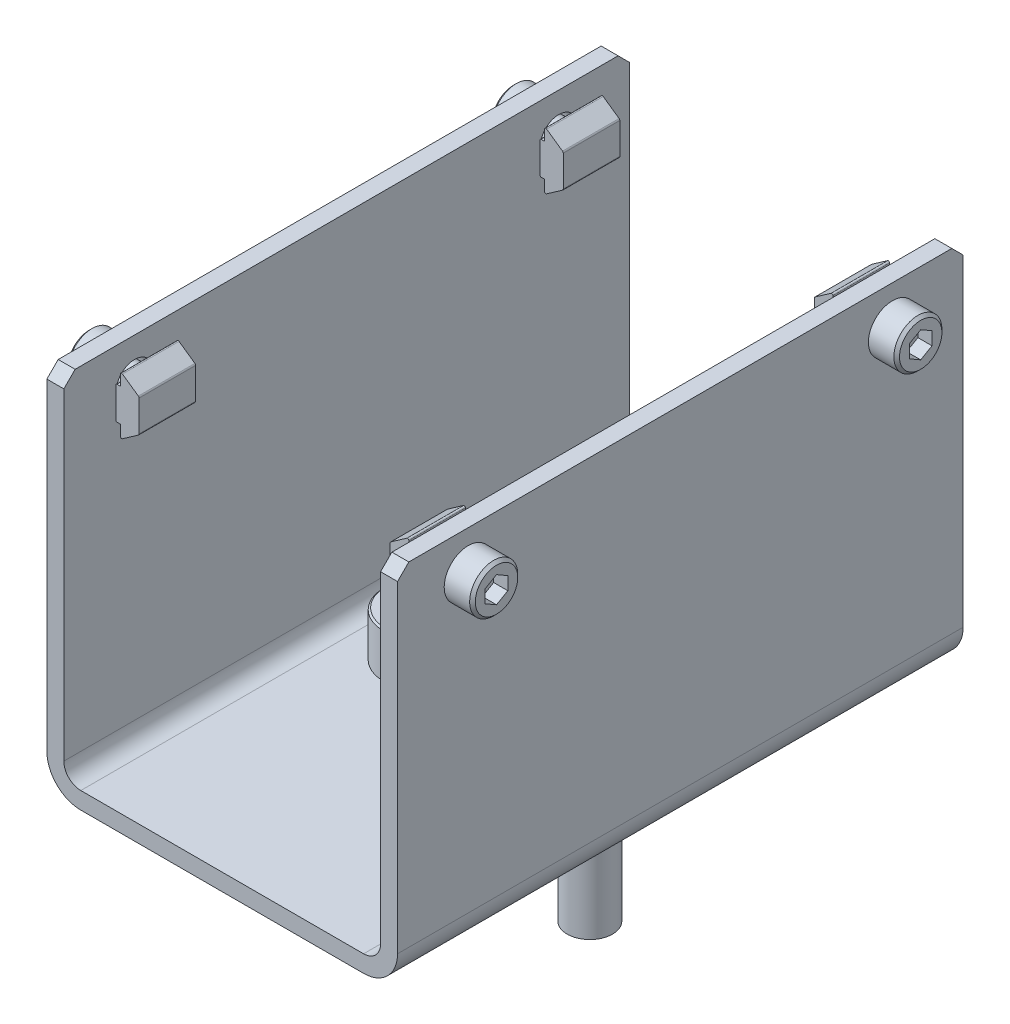
from build123d import *

# Parameters (mm, degrees)
BOSS_EXTRUDE1_DEPTH      = 50
SKETCH2_R                = 3.25
CUT_EXTRUDE1_DEPTH       = 103.805641869
CHAMFER1_SIZE            = 2
SKETCH3_R                = 4.5
CUT_EXTRUDE2_DEPTH       = 86.469292731
CUT_EXTRUDE3_DEPTH       = 2.5
CHAMFER2_SIZE            = 0.5
BOSS_EXTRUDE2_DEPTH      = 5
CHAMFER2_OF_MIRROR1_SIZE = 0.5
CUT_EXTRUDE4_DEPTH       = 4
CHAMFER3_SIZE            = 0.3


# Read off the part's stored shape, not the designer's step: Mirror2
with BuildPart() as part:
    # Sketch1 → Boss-Extrude1 (new, symmetric)
    with BuildSketch(Plane.XY):
        with BuildLine():
            Line((-25, 0), (25, 0))
            ThreePointArc((25, 0), (29.242640687, 1.757359313), (31, 6))
            Line((31, 6), (31, 65))
            Line((31, 65), (28, 65))
            Line((28, 65), (28, 6))
            ThreePointArc((28, 6), (27.121320344, 3.878679656), (25, 3))
            Line((25, 3), (-25, 3))
            ThreePointArc((-25, 3), (-27.121320344, 3.878679656), (-28, 6))
            Line((-28, 6), (-28, 65))
            Line((-28, 65), (-31, 65))
            Line((-31, 65), (-31, 6))
            ThreePointArc((-31, 6), (-29.242640687, 1.757359313), (-25, 0))
        make_face()
    extrude(amount=BOSS_EXTRUDE1_DEPTH, both=True)

    # Sketch2 → Cut-Extrude1 (cut, through all)
    with BuildSketch(Plane(origin=(31, 0, 0), x_dir=(0, 0, -1), z_dir=(1, 0, 0))):
        with Locations((-37.5, 58)):
            Circle(SKETCH2_R)
        with Locations((37.5, 58)):
            Circle(SKETCH2_R)
    extrude(amount=-CUT_EXTRUDE1_DEPTH, mode=Mode.SUBTRACT)

    # Chamfer1
    chamfer1_edges = [part.edges().sort_by_distance(p)[0] for p in [
        (-29.5, 65, -50),
        (29.5, 65, -50),
        (29.5, 65, 50),
        (-29.5, 65, 50),
    ]]
    chamfer(chamfer1_edges, length=CHAMFER1_SIZE)

    # Sketch3 → Cut-Extrude2 (cut, through all)
    with BuildSketch(Plane(origin=(0, 3, 0), x_dir=(1, 0, 0), z_dir=(0, 1, 0))):
        with Locations(Location((-15, 0, 0), (0, 0, 180))):
            Circle(SKETCH3_R)
        with Locations(Location((15, 0, 0), (0, 0, 180))):
            Circle(SKETCH3_R)
    extrude(amount=-CUT_EXTRUDE2_DEPTH, mode=Mode.SUBTRACT)

    # Sketch4 → Revolve1 (revolve)
    with BuildSketch(Plane(origin=(0, 58, 0), x_dir=(1, 0, 0), z_dir=(0, 1, 0)), mode=Mode.PRIVATE) as revolve1_sk:
        Polygon((23, -40), (31, -40), (31, -41.75), (36, -41.75), (36, -37.5), (23, -37.5), align=None)
    revolve1 = revolve(revolve1_sk.sketch.rotate(Axis((36, 58, 37.5), (-1, 0, 0)), 180), axis=Axis((36, 58, 37.5), (-1, 0, 0)))

    # Sketch5 → Cut-Extrude3 (cut)
    with BuildSketch(Plane(origin=(36, 0, 0), x_dir=(0, 0, -1), z_dir=(1, 0, 0))):
        Polygon((-37.5, 60.309401077), (-39.5, 59.154700538), (-39.5, 56.845299462), (-37.5, 55.690598923), (-35.5, 56.845299462), (-35.5, 59.154700538), align=None)
    cut_extrude3 = extrude(amount=-CUT_EXTRUDE3_DEPTH, mode=Mode.SUBTRACT)

    # Chamfer2
    chamfer2_edges = [part.edges().sort_by_distance(p)[0] for p in [
        (36, 58, 41.75),
    ]]
    chamfer(chamfer2_edges, length=CHAMFER2_SIZE)

    # Sketch6 → Boss-Extrude2 (add, symmetric)
    with BuildSketch(Plane.XY.offset(37.5)):
        with BuildLine():
            Line((22.2, 60.743829885), (22.2, 55.256170115))
            ThreePointArc((22.2, 55.256170115), (22.23389675, 55.117645531), (22.327927069, 55.010424502))
            Line((22.327927069, 55.010424502), (25.140026938, 53.041370976))
            ThreePointArc((25.140026938, 53.041370976), (25.376869026, 53.025847525), (25.5, 53.228761091))
            Line((25.5, 53.228761091), (25.5, 55.1))
            Line((25.5, 55.1), (26.1, 55.1))
            ThreePointArc((26.1, 55.1), (26.241421356, 55.158578644), (26.3, 55.3))
            Line((26.3, 55.3), (26.3, 60.7))
            ThreePointArc((26.3, 60.7), (26.241421356, 60.841421356), (26.1, 60.9))
            Line((26.1, 60.9), (25.5, 60.9))
            Line((25.5, 60.9), (25.5, 62.771238909))
            ThreePointArc((25.5, 62.771238909), (25.376869026, 62.974152475), (25.140026938, 62.958629024))
            Line((25.140026938, 62.958629024), (22.327927069, 60.989575498))
            ThreePointArc((22.327927069, 60.989575498), (22.23389675, 60.882354469), (22.2, 60.743829885))
        make_face()
    boss_extrude2 = extrude(amount=BOSS_EXTRUDE2_DEPTH, both=True)

    # Mirror1: Revolve1, Cut-Extrude3, Boss-Extrude2 across plane
    add(revolve1.mirror(Plane.XY))
    add(cut_extrude3.mirror(Plane.XY), mode=Mode.SUBTRACT)
    add(boss_extrude2.mirror(Plane.XY))

    # Chamfer2 of Mirror1
    chamfer2_of_mirror1_edges = [part.edges().sort_by_distance(p)[0] for p in [
        (36, 58, -41.75),
    ]]
    chamfer(chamfer2_of_mirror1_edges, length=CHAMFER2_OF_MIRROR1_SIZE)

    # Sketch7 → Revolve2 (revolve)
    with BuildSketch(Plane.XY, mode=Mode.PRIVATE) as revolve2_sk:
        Polygon((18, 11), (21.5, 11), (21.5, 3), (19, 3), (19, -22), (15, -22), (15, 5.267949192), (18, 7), align=None)
    revolve(revolve2_sk.sketch.rotate(Axis((15, 11, 0), (0, -1, 0)), 180), axis=Axis((15, 11, 0), (0, -1, 0)))

    # Sketch8 → Cut-Extrude4 (cut)
    with BuildSketch(Plane(origin=(0, 11, 0), x_dir=(1, 0, 0), z_dir=(0, 1, 0))):
        Polygon((15, 3.464101615), (12, 1.732050808), (12, -1.732050808), (15, -3.464101615), (18, -1.732050808), (18, 1.732050808), align=None)
    extrude(amount=-CUT_EXTRUDE4_DEPTH, mode=Mode.SUBTRACT)

    # Chamfer3
    chamfer3_edges = [part.edges().sort_by_distance(p)[0] for p in [
        (21.5, 11, 0),
    ]]
    chamfer(chamfer3_edges, length=CHAMFER3_SIZE)

    # Mirror2: part across plane


with BuildPart() as part_1:
    add(part.part)
    add(part.part.mirror(Plane(origin=(0, 0, 0), x_dir=(0, 0, 1), z_dir=(1, 0, 0))))


solid = part_1.part
